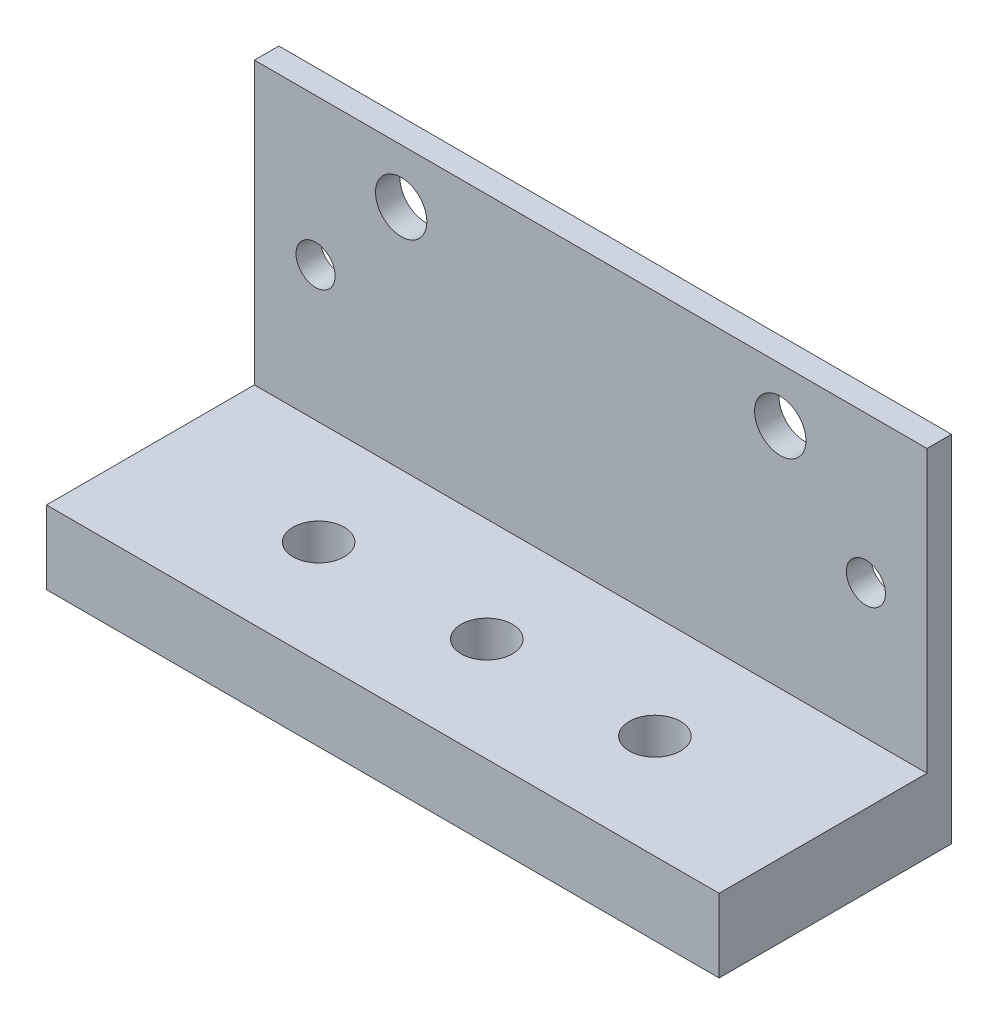
from build123d import *

# Parameters (mm, degrees)
ESQUISSE1_W             = 275
ESQUISSE1_H             = 145
ESQUISSE1_R             = 10.5
ESQUISSE1_R_2           = 8
BOSS_EXTRU_1_DEPTH      = 10
ESQUISSE2_W             = 275
ESQUISSE2_H             = 95
BOSS_EXTRU_2_DEPTH      = 30
ESQUISSE4_R             = 10.5
ENL_V_MAT_EXTRU_1_DEPTH = 313.849804219


with BuildPart() as part:
    # Esquisse1 → Boss.-Extru.1 (new body)
    with BuildSketch(Plane.XY):
        with Locations((137.5, 72.5)):
            Rectangle(ESQUISSE1_W, ESQUISSE1_H)
        with Locations((60, 123)):
            Circle(ESQUISSE1_R, mode=Mode.SUBTRACT)
        with Locations((25, 85)):
            Circle(ESQUISSE1_R_2, mode=Mode.SUBTRACT)
        with Locations((250, 85)):
            Circle(ESQUISSE1_R_2, mode=Mode.SUBTRACT)
        with Locations((215, 123)):
            Circle(ESQUISSE1_R, mode=Mode.SUBTRACT)
    extrude(amount=BOSS_EXTRU_1_DEPTH)

    # Esquisse2 → Boss.-Extru.2 (add)
    with BuildSketch(Plane(origin=(0, 0, 0), x_dir=(1, 0, 0), z_dir=(0, 1, 0))):
        with Locations((137.5, -47.5)):
            Rectangle(ESQUISSE2_W, ESQUISSE2_H)
    extrude(amount=BOSS_EXTRU_2_DEPTH)

    # Esquisse4 → Enlèv. mat.-Extru.1 (cut, through all)
    with BuildSketch(Plane(origin=(0, 30, 0), x_dir=(1, 0, 0), z_dir=(0, 1, 0))):
        with Locations((206.25, -52.5)):
            Circle(ESQUISSE4_R)
        with Locations((137.5, -52.5)):
            Circle(ESQUISSE4_R)
        with Locations((68.75, -52.5)):
            Circle(ESQUISSE4_R)
    extrude(amount=-ENL_V_MAT_EXTRU_1_DEPTH, mode=Mode.SUBTRACT)


solid = part.part
